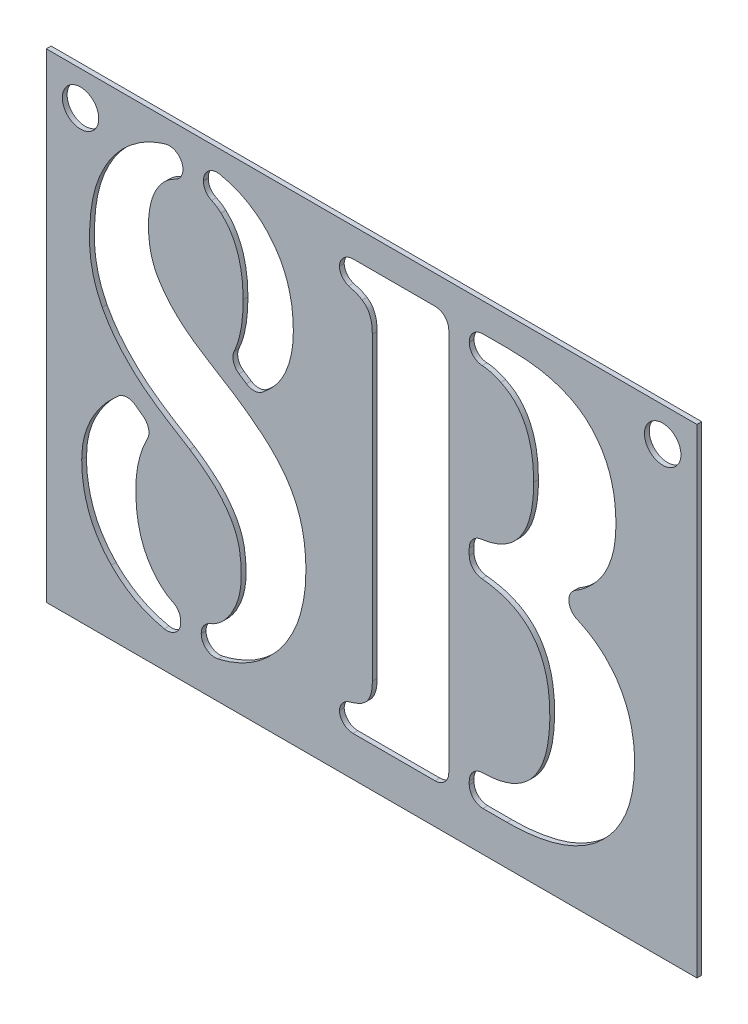
from build123d import *

# Parameters (mm, degrees)
SKETCH1_W           = 120.65
SKETCH1_H           = 88.9
BASE_FLANGE1_DEPTH  = 0.889
SKETCH6_R           = 3.3782
CUT_EXTRUDE1_DEPTH  = 150.868018006
BOSS_EXTRUDE1_DEPTH = 0.889
FILLET1_R           = 2.54
FILLET2_START       = -2
FILLET2_DEPTH       = 3
FILLET2_START_2     = -0.889
FILLET2_2_DEPTH     = 0.889
FILLET3_R           = 2.54


with BuildPart() as part:
    # Base-Flange1: sheet metal written as solids
    # Sketch1 → Base-Flange1 (new body)
    with BuildSketch(Plane.XY):
        with Locations((60.325, 44.45)):
            Rectangle(SKETCH1_W, SKETCH1_H)
    extrude(amount=-BASE_FLANGE1_DEPTH)

    # Sketch6 → Cut-Extrude1 (cut, through all)
    with BuildSketch(Plane.XY):
        with Locations((6.35, 82.55)):
            Circle(SKETCH6_R)
        with Locations((114.3, 82.55)):
            Circle(SKETCH6_R)
        with BuildLine():
            add(Edge.make_bspline(
                [(33.721944791, 55.915194745), (33.945566555, 56.239468675), (34.400665819, 56.899408137), (34.977526537, 57.993937195), (35.450382533, 59.205034013), (35.824194009, 60.526968997), (36.128276898, 61.954453154), (36.348507191, 63.488103854), (36.473228553, 65.13890108), (36.492436497, 66.274115113), (36.502386826, 66.862192243)],
                knots=[0, 0, 0, 0, 0.822761363, 1.674425973, 2.578837131, 3.535199884, 4.542538217, 5.627355092, 6.770894149, 8, 8, 8, 8], degree=3))
            add(Edge.make_bspline(
                [(36.502386826, 66.862192243), (36.491019076, 67.519374521), (36.469056923, 68.789030968), (36.27782028, 70.622482793), (35.960704025, 72.317877956), (35.527108867, 73.884134707), (34.930507519, 75.300528242), (34.23652802, 76.59231579), (33.386691426, 77.72991134), (32.729046696, 78.388517336), (32.403220854, 78.714819433)],
                knots=[0, 0, 0, 0, 1.221156418, 2.35923757, 3.420995774, 4.424200893, 5.372906847, 6.271581767, 7.143666327, 8, 8, 8, 8], degree=3))
            add(Edge.make_bspline(
                [(32.403220854, 78.714819433), (32.165622252, 78.919035816), (31.695385611, 79.32320497), (30.890425669, 79.780138509), (30.039324301, 80.122290806), (29.445096394, 80.253512256), (29.146131613, 80.319531693)],
                knots=[0, 0, 0, 0, 1.019726564, 2.018163364, 3.002908904, 4, 4, 4, 4], degree=3))
            Line((29.146131613, 80.319531693), (29.146131613, 85.260774395))
            add(Edge.make_bspline(
                [(29.146131613, 85.260774395), (29.756585845, 85.202127091), (30.952555803, 85.087228365), (32.694140211, 84.744209224), (34.347778719, 84.295177747), (35.901973134, 83.68577925), (37.352498383, 82.935211663), (38.707878436, 82.056078101), (39.98077677, 81.056030121), (40.731746439, 80.280931788), (41.109976484, 79.890549207)],
                knots=[0, 0, 0, 0, 1.094237954, 2.143773687, 3.164595698, 4.149585034, 5.117961823, 6.075196801, 7.030562178, 8, 8, 8, 8], degree=3))
            add(Edge.make_bspline(
                [(41.109976484, 79.890549207), (41.483320478, 79.457409669), (42.229880258, 78.591279336), (43.205611424, 77.178748314), (43.997062754, 75.643877981), (44.67711555, 74.023214816), (45.170846206, 72.27559908), (45.565996477, 70.436588782), (45.759174965, 68.486869581), (45.794733167, 67.159081803), (45.812895583, 66.480874478)],
                knots=[0, 0, 0, 0, 0.942313705, 1.884303813, 2.821548553, 3.784583717, 4.776355046, 5.810525993, 6.88166066, 8, 8, 8, 8], degree=3))
            add(Edge.make_bspline(
                [(45.812895583, 66.480874478), (45.802665966, 65.902903199), (45.78260664, 64.769555345), (45.5675645, 63.116958505), (45.239433358, 61.552328844), (44.773095776, 60.07992146), (44.191890051, 58.688232618), (43.451158601, 57.399966635), (42.596636904, 56.188948298), (41.913947772, 55.478134391), (41.57073545, 55.120782735)],
                knots=[0, 0, 0, 0, 1.112832737, 2.182161362, 3.204715081, 4.188883333, 5.153447973, 6.103825068, 7.046724824, 8, 8, 8, 8], degree=3))
            add(Edge.make_bspline(
                [(41.57073545, 55.120782735), (41.111278913, 54.694527786), (40.173059358, 53.824106544), (39.152295482, 53.052068132), (38.631411013, 52.658105504)],
                knots=[0, 0, 0, 0, 0.979422212, 2, 2, 2, 2], degree=3))
            Line((38.631411013, 52.658105504), (33.721944791, 55.915194745))
        make_face()
        with BuildLine():
            add(Edge.make_bspline(
                [(19.883287576, 37.421283152), (19.616133771, 37.034156188), (19.082318391, 36.260615542), (18.417754654, 35.012090787), (17.857420287, 33.697964052), (17.404293727, 32.319496353), (17.027789, 30.878279992), (16.784199453, 29.36184477), (16.616481313, 27.780901635), (16.601836045, 26.70247569), (16.594421855, 26.15652085)],
                knots=[0, 0, 0, 0, 0.945460815, 1.889179619, 2.838951615, 3.815876358, 4.805439124, 5.83170644, 6.902297958, 8, 8, 8, 8], degree=3))
            add(Edge.make_bspline(
                [(16.594421855, 26.15652085), (16.609762609, 25.462097074), (16.639473468, 24.117187454), (16.865562184, 22.166698244), (17.227658965, 20.347745192), (17.731504426, 18.65080593), (18.398671097, 17.088594313), (19.218300392, 15.663196806), (20.164782775, 14.358836161), (20.92117593, 13.6111944), (21.297340954, 13.239381568)],
                knots=[0, 0, 0, 0, 1.177536091, 2.280566521, 3.325179602, 4.319742052, 5.277440658, 6.198814698, 7.10424505, 8, 8, 8, 8], degree=3))
            add(Edge.make_bspline(
                [(21.297340954, 13.239381568), (21.562084121, 13.010044579), (22.088059724, 12.554411815), (22.968825281, 11.995673844), (23.918999957, 11.563392679), (24.583669193, 11.357494897), (24.91985972, 11.253351543)],
                knots=[0, 0, 0, 0, 1.006551345, 1.999754922, 2.988273549, 4, 4, 4, 4], degree=3))
            Line((24.91985972, 11.253351543), (24.91985972, 6.327997081))
            add(Edge.make_bspline(
                [(24.91985972, 6.327997081), (24.293622496, 6.374809775), (23.054852732, 6.467410708), (21.244917387, 6.803125292), (19.514866894, 7.30426418), (17.862938713, 7.933798354), (16.287323527, 8.721304592), (14.796919454, 9.663289271), (13.365956526, 10.741996816), (12.502833966, 11.577505264), (12.066273398, 12.000098832)],
                knots=[0, 0, 0, 0, 1.047151902, 2.071387751, 3.064194013, 4.048748296, 5.016869866, 5.997491081, 6.987146818, 8, 8, 8, 8], degree=3))
            add(Edge.make_bspline(
                [(12.066273398, 12.000098832), (11.625333996, 12.466847097), (10.748780669, 13.394706441), (9.652728538, 14.953790064), (8.669071406, 16.57875351), (7.92709237, 18.33693812), (7.305421606, 20.176152507), (6.891899081, 22.122647327), (6.60295647, 24.161841581), (6.580422157, 25.556993189), (6.568942289, 26.267738532)],
                knots=[0, 0, 0, 0, 0.980085918, 1.948334778, 2.906208818, 3.877666549, 4.85801983, 5.869425845, 6.914601361, 8, 8, 8, 8], degree=3))
            add(Edge.make_bspline(
                [(6.568942289, 26.267738532), (6.591184344, 26.958376825), (6.635362827, 28.330163385), (7.059278134, 30.351284056), (7.69956002, 32.318360092), (8.649621943, 34.2027737), (9.812563235, 36.053646292), (11.26863013, 37.824291986), (12.982759879, 39.536631474), (14.265012803, 40.583477629), (14.926156634, 41.123243119)],
                knots=[0, 0, 0, 0, 0.936383992, 1.859901176, 2.792025208, 3.737309031, 4.716592954, 5.754079214, 6.841978331, 8, 8, 8, 8], degree=3))
            Line((14.926156634, 41.123243119), (19.883287576, 37.421283152))
        make_face()
        with BuildLine():
            add(Edge.make_bspline(
                [(26.635789661, 37.850265638), (26.039686526, 38.235384203), (24.860658309, 38.997107516), (23.34318736, 39.898942842), (22.092245717, 40.667911279), (21.075141819, 41.348827271), (19.952396385, 42.114761342), (18.322797978, 43.286540288), (16.267098536, 44.992221903), (13.976278213, 47.323871576), (11.927541966, 49.827349173), (10.873461874, 51.663378568), (10.366231696, 52.546887823)],
                knots=[0, 0, 0, 0, 0.957997565, 1.894816677, 2.382894246, 2.940122698, 3.546974634, 4.217726517, 5.649479433, 7.145999402, 8.6266364, 10, 10, 10, 10], degree=3))
            add(Edge.make_bspline(
                [(10.366231696, 52.546887823), (10.000313966, 53.311535184), (9.268593137, 54.840590365), (8.560004187, 57.291999002), (8.09775042, 59.820913851), (7.97979366, 62.397459272), (8.069223305, 64.912208426), (8.276955666, 67.287357049), (8.657611603, 69.471289608), (9.185123829, 71.479958251), (9.85036622, 73.338819652), (10.679173927, 75.058289068), (11.581074031, 76.691668189), (12.309636946, 77.683835584), (12.670026525, 78.174619266)],
                knots=[0, 0, 0, 0, 1.129177947, 2.258002154, 3.391746644, 4.552233604, 5.690328946, 6.747726653, 7.730442153, 8.64388975, 9.515557073, 10.359434416, 11.188480873, 12, 12, 12, 12], degree=3))
            add(Edge.make_bspline(
                [(12.670026525, 78.174619266), (13.0775734, 78.676937987), (13.88198963, 79.668414936), (15.259365749, 80.965887267), (16.720469178, 82.103566701), (18.253164362, 83.096673513), (19.899694607, 83.896097827), (21.629158153, 84.530289507), (23.455969981, 84.998011187), (24.711124038, 85.172248149), (25.348842205, 85.260774395)],
                knots=[0, 0, 0, 0, 1.038259764, 2.049317656, 3.031389794, 4.010915357, 4.977457628, 5.965372969, 6.966247518, 8, 8, 8, 8], degree=3))
            Line((25.348842205, 85.260774395), (25.348842205, 80.367196413))
            add(Edge.make_bspline(
                [(25.348842205, 80.367196413), (24.884788281, 80.245952492), (23.961589675, 80.004747294), (22.715597501, 79.246928611), (21.60224196, 78.247448168), (20.657959097, 76.978148231), (19.873806951, 75.504628615), (19.342445028, 73.818032714), (19.009817626, 71.96571066), (18.913856923, 69.997439887), (19.0049849, 68.044835318), (19.267451392, 66.221865267), (19.703497286, 64.583106765), (20.53730275, 62.682643728), (21.920667043, 60.607391044), (23.84901457, 58.397699741), (26.04403569, 56.507741221), (28.424702875, 54.806143471), (31.049023747, 53.211039001), (33.854845214, 51.471969087), (36.791465186, 49.542865534), (39.192261275, 47.717549888), (41.035602971, 46.163668204), (42.30835153, 44.942111166), (43.448219585, 43.68580327), (44.119076586, 42.796550364), (44.446506926, 42.362525855)],
                knots=[0, 0, 0, 0, 0.656148608, 1.305355797, 1.980607929, 2.702729208, 3.467923402, 4.264401579, 5.12252757, 6.048403816, 6.966636849, 7.805654903, 8.575612407, 9.28961639, 10.648530219, 11.984537431, 13.310272413, 14.619355613, 16.002846876, 17.529855676, 19.157104223, 20.829921906, 21.671588303, 22.469561966, 23.25302733, 24, 24, 24, 24], degree=3))
            add(Edge.make_bspline(
                [(44.446506926, 42.362525855), (44.746305022, 41.917587426), (45.344141131, 41.030322755), (46.093789274, 39.595835723), (46.722777946, 38.089131604), (47.258696634, 36.504981115), (47.646892464, 34.832569937), (47.930900327, 33.086185862), (48.110981675, 31.260360003), (48.13577674, 30.017785246), (48.148466892, 29.381833611)],
                knots=[0, 0, 0, 0, 0.938169888, 1.870831882, 2.826009256, 3.793024893, 4.79321492, 5.826095895, 6.887392601, 8, 8, 8, 8], degree=3))
            add(Edge.make_bspline(
                [(48.148466892, 29.381833611), (48.13445697, 28.607979387), (48.106838063, 27.082417184), (47.851705837, 24.843527321), (47.412218923, 22.707154681), (46.8546659, 20.656210045), (46.083831038, 18.719101874), (45.153564155, 16.874483359), (44.066658288, 15.122099031), (43.207667184, 14.046962308), (42.778241705, 13.509481651)],
                knots=[0, 0, 0, 0, 1.084919702, 2.138791053, 3.153956352, 4.141443254, 5.115093293, 6.071627084, 7.035970851, 8, 8, 8, 8], degree=3))
            add(Edge.make_bspline(
                [(42.778241705, 13.509481651), (42.321995701, 13.001960239), (41.421423276, 12.000176587), (39.90841846, 10.675998716), (38.30455025, 9.512183787), (36.59200664, 8.518268183), (34.774616687, 7.70726043), (32.85140017, 7.074268757), (30.832846743, 6.58659523), (29.43973319, 6.415028901), (28.733037368, 6.327997081)],
                knots=[0, 0, 0, 0, 1.011225634, 1.996032651, 2.974714502, 3.945899917, 4.926690626, 5.92007151, 6.944898088, 8, 8, 8, 8], degree=3))
            Line((28.733037368, 6.327997081), (28.733037368, 11.253351543))
            add(Edge.make_bspline(
                [(28.733037368, 11.253351543), (29.305129151, 11.401063681), (30.438440622, 11.69368082), (31.957750216, 12.615561733), (33.308802054, 13.845857971), (33.977697082, 14.889165294), (34.325697918, 15.431958715)],
                knots=[0, 0, 0, 0, 0.980340632, 1.942050765, 2.929326687, 4, 4, 4, 4], degree=3))
            add(Edge.make_bspline(
                [(34.325697918, 15.431958715), (34.606241209, 15.949161238), (35.167555764, 16.983986569), (35.729688129, 18.675424926), (36.090299837, 20.4470916), (36.174377592, 22.26340367), (36.130592962, 24.00485288), (35.972298383, 25.592320262), (35.731207827, 26.978330959), (35.263563781, 28.541410796), (34.467188249, 30.267801121), (33.227870454, 32.103828162), (31.81735753, 33.797685683), (30.160739126, 35.256948147), (28.441997153, 36.626235469), (27.234412579, 37.444591033), (26.635789661, 37.850265638)],
                knots=[0, 0, 0, 0, 0.934486164, 1.869731703, 2.823169704, 3.802321356, 4.754753641, 5.593136125, 6.338459668, 6.988927459, 8.184121003, 9.345545268, 10.505287395, 11.680202914, 12.850031932, 14, 14, 14, 14], degree=3))
        make_face()
        with BuildLine():
            add(Edge.make_bspline(
                [(78.431452714, 50.338422435), (78.914186188, 50.343534872), (79.851337753, 50.35345987), (81.209042658, 50.546186921), (82.483455836, 50.794090968), (83.652381804, 51.209573269), (84.738299018, 51.688888938), (85.72601258, 52.305788518), (86.611115618, 53.038560154), (87.416395155, 53.871090917), (88.119811677, 54.817024849), (88.720123224, 55.878189845), (89.253734078, 57.037113933), (89.652870045, 58.322511818), (89.998060508, 59.704427528), (90.203211067, 61.206643551), (90.356139459, 62.812833576), (90.371490454, 63.922445457), (90.379409344, 64.494844453)],
                knots=[0, 0, 0, 0, 1.091324336, 2.118635568, 3.098931437, 4.023802071, 4.919554848, 5.780968474, 6.649606692, 7.514266393, 8.396443925, 9.309275326, 10.269507892, 11.27776313, 12.350499074, 13.489616614, 14.705005818, 16, 16, 16, 16], degree=3))
            add(Edge.make_bspline(
                [(90.379409344, 64.494844453), (90.362909376, 65.300794245), (90.331314035, 66.844085571), (90.044235787, 69.048346549), (89.579563223, 71.030292376), (88.911733248, 72.786899467), (88.049998881, 74.319586877), (86.992623768, 75.625941355), (85.733489604, 76.705860479), (84.766142603, 77.217516709), (84.278325108, 77.475536697)],
                knots=[0, 0, 0, 0, 1.273550566, 2.438687324, 3.506778572, 4.484739009, 5.399599483, 6.274353955, 7.129784522, 8, 8, 8, 8], degree=3))
            add(Edge.make_bspline(
                [(84.278325108, 77.475536697), (83.941650027, 77.624169638), (83.309156363, 77.903398483), (82.370378587, 78.217280556), (81.50473873, 78.396623762), (80.947750412, 78.429406588), (80.687582822, 78.444719349)],
                knots=[0, 0, 0, 0, 1.178588215, 2.214151332, 3.16583539, 4, 4, 4, 4], degree=3))
            Line((80.687582822, 78.444719349), (78.90809992, 78.444719349))
            add(Edge.make_bspline(
                [(78.90809992, 78.444719349), (78.823179878, 78.44120605), (78.663346585, 78.43459345), (78.505455608, 78.409034166), (78.431452714, 78.397054629)],
                knots=[0, 0, 0, 0, 1.062607685, 2, 2, 2, 2], degree=3))
            Line((78.431452714, 78.397054629), (78.431452714, 83.592509174))
            Line((78.431452714, 83.592509174), (85.771819686, 83.592509174))
            add(Edge.make_bspline(
                [(85.771819686, 83.592509174), (86.593295137, 83.57739494), (88.1811475, 83.548180225), (90.479690198, 83.320532346), (92.613981983, 82.968741198), (94.58054334, 82.440282196), (96.385684195, 81.774194779), (98.035910107, 80.969458038), (99.507937921, 79.994360178), (100.803085526, 78.871317705), (101.946466694, 77.619129226), (102.92584842, 76.230332344), (103.779119131, 74.729184238), (104.463055629, 73.096294806), (104.982051978, 71.336285303), (105.36523783, 69.455252724), (105.585085138, 67.444674946), (105.616151183, 66.063017302), (105.632119937, 65.352809424)],
                knots=[0, 0, 0, 0, 1.277015389, 2.468377965, 3.587940399, 4.636606522, 5.62930242, 6.575735692, 7.484709474, 8.366265355, 9.234802907, 10.114510821, 11.00311497, 11.914621549, 12.860302246, 13.851870449, 14.895805674, 16, 16, 16, 16], degree=3))
            add(Edge.make_bspline(
                [(105.632119937, 65.352809424), (105.621620093, 64.748418041), (105.601015993, 63.562406085), (105.389212339, 61.829189675), (105.048669411, 60.187807511), (104.540037741, 58.646012613), (103.935242155, 57.182925056), (103.160875961, 55.822289785), (102.251936188, 54.55182302), (101.541682599, 53.789425455), (101.183412681, 53.404852794)],
                knots=[0, 0, 0, 0, 1.107259912, 2.172803139, 3.195158917, 4.174395064, 5.144350059, 6.091898045, 7.037504995, 8, 8, 8, 8], degree=3))
            add(Edge.make_bspline(
                [(101.183412681, 53.404852794), (100.850852835, 53.079818637), (100.18315045, 52.427226076), (99.061560861, 51.577070115), (97.864921594, 50.803991067), (96.570743336, 50.144502392), (95.204588446, 49.551672158), (93.748732211, 49.058079808), (92.206695951, 48.663642468), (91.143346127, 48.467940257), (90.601844707, 48.36828065)],
                knots=[0, 0, 0, 0, 0.935390857, 1.878046054, 2.827491028, 3.800356325, 4.798599963, 5.823646477, 6.891711368, 8, 8, 8, 8], degree=3))
            Line((90.601844707, 48.36828065), (90.601844707, 48.145845287))
            add(Edge.make_bspline(
                [(90.601844707, 48.145845287), (91.254311213, 48.109340586), (92.527815788, 48.038089565), (94.388012008, 47.744948162), (96.150879068, 47.315633741), (97.829983634, 46.763887943), (99.41414506, 46.05767446), (100.903914782, 45.218138181), (102.307493315, 44.242636563), (103.155462263, 43.488892174), (103.582536951, 43.109273144)],
                knots=[0, 0, 0, 0, 1.101209382, 2.149374987, 3.169399366, 4.157664196, 5.125014668, 6.088566413, 7.037317457, 8, 8, 8, 8], degree=3))
            add(Edge.make_bspline(
                [(103.582536951, 43.109273144), (104.021055625, 42.65708822), (104.894149366, 41.756784881), (106.032072067, 40.255501668), (106.964512901, 38.61798182), (107.757722813, 36.873015222), (108.354889203, 34.994218997), (108.777144679, 32.992634668), (109.061526679, 30.878161798), (109.084180972, 29.425166512), (109.0957563, 28.682751042)],
                knots=[0, 0, 0, 0, 0.950924961, 1.893298235, 2.835943106, 3.791969056, 4.783677115, 5.806704274, 6.879324186, 8, 8, 8, 8], degree=3))
            add(Edge.make_bspline(
                [(109.0957563, 28.682751042), (109.077095535, 27.924589696), (109.040565078, 26.44040723), (108.764996011, 24.270879528), (108.321494811, 22.212713667), (107.70966695, 20.26335733), (106.883992907, 18.437992226), (105.902346581, 16.719571946), (104.737917958, 15.107212438), (103.822040076, 14.150764656), (103.360101588, 13.668364053)],
                knots=[0, 0, 0, 0, 1.101506446, 2.156317467, 3.172227974, 4.157956163, 5.119102677, 6.077503008, 7.030356151, 8, 8, 8, 8], degree=3))
            add(Edge.make_bspline(
                [(103.360101588, 13.668364053), (102.821752903, 13.160742023), (101.742847479, 12.143415935), (99.888615193, 10.882641979), (97.897530464, 9.790790704), (95.725501332, 8.914476228), (93.387241714, 8.237309463), (90.882762557, 7.750863491), (88.215907579, 7.438434066), (86.381782885, 7.408110151), (85.438166642, 7.392509174)],
                knots=[0, 0, 0, 0, 0.909610263, 1.82295132, 2.75069913, 3.701101728, 4.699660518, 5.743017525, 6.83883286, 8, 8, 8, 8], degree=3))
            Line((85.438166642, 7.392509174), (78.431452714, 7.392509174))
            Line((78.431452714, 7.392509174), (78.431452714, 13.287046288))
            add(Edge.make_bspline(
                [(78.431452714, 13.287046288), (78.737722382, 13.225405107), (79.470983671, 13.077825714), (80.219772656, 13.079515293), (80.655806342, 13.080499166)],
                knots=[0, 0, 0, 0, 0.83536298, 2, 2, 2, 2], degree=3))
            add(Edge.make_bspline(
                [(80.655806342, 13.080499166), (81.169796853, 13.094261725), (82.169082301, 13.121018494), (83.621052251, 13.282675706), (84.959804208, 13.617674154), (86.218400631, 14.014166542), (87.362812894, 14.582842276), (88.424250625, 15.250438516), (89.385655658, 16.047502281), (90.226271024, 16.982505815), (90.986766659, 18.018647021), (91.609987508, 19.194575883), (92.179682219, 20.467159539), (92.6133997, 21.877849953), (92.969191098, 23.405763504), (93.190250714, 25.060933543), (93.359669001, 26.830719359), (93.398536078, 28.683065689), (93.341962977, 30.534977721), (93.167209182, 32.30791708), (92.891477376, 33.963615692), (92.475880799, 35.494269941), (91.953272283, 36.900429906), (91.316276891, 38.189440809), (90.545236756, 39.350596376), (89.678519971, 40.414177507), (88.657119458, 41.319249352), (87.544250582, 42.123502059), (86.305381056, 42.785977118), (84.965866992, 43.357649317), (83.490566026, 43.748105076), (81.913553199, 44.08342594), (80.208926149, 44.24444278), (79.035426816, 44.271220843), (78.431452714, 44.285002919)],
                knots=[0, 0, 0, 0, 1.032210394, 2.006793518, 2.924873458, 3.799053519, 4.650236015, 5.482006028, 6.312415829, 7.147779697, 8.000620709, 8.885660565, 9.814086946, 10.795950511, 11.843111406, 12.960313531, 14.145279367, 15.410926016, 16.676885242, 17.862852357, 18.985052045, 20.042525811, 21.041793083, 21.99277562, 22.921688917, 23.835139697, 24.738447969, 25.653073686, 26.585630746, 27.553170773, 28.569655006, 29.643518112, 30.787170992, 32, 32, 32, 32], degree=3))
            Line((78.431452714, 44.285002919), (78.431452714, 50.338422435))
        make_face()
        with BuildLine():
            Line((74.634163306, 7.392509174), (54.34488057, 7.392509174))
            Line((54.34488057, 7.392509174), (54.34488057, 11.364569224))
            add(Edge.make_bspline(
                [(54.34488057, 11.364569224), (54.722441586, 11.543878551), (55.448531767, 11.888709548), (56.570451278, 12.233150923), (57.630109614, 12.562797312), (58.26321512, 12.911091648), (58.571152464, 13.080499166)],
                knots=[0, 0, 0, 0, 1.095819923, 2.10737882, 3.079444527, 4, 4, 4, 4], degree=3))
            add(Edge.make_bspline(
                [(58.571152464, 13.080499166), (58.865883479, 13.301310208), (59.473748669, 13.756719849), (60.04438792, 14.829452415), (60.423559426, 16.115041325), (60.448439346, 17.064813327), (60.461853048, 17.576871142)],
                knots=[0, 0, 0, 0, 0.858619286, 1.77085121, 2.798182029, 4, 4, 4, 4], degree=3))
            Line((60.461853048, 17.576871142), (60.461853048, 73.296929524))
            add(Edge.make_bspline(
                [(60.461853048, 73.296929524), (60.448503503, 73.81939649), (60.423843752, 74.784515998), (60.048645877, 76.088608147), (59.469297238, 77.1649914), (58.865398146, 77.630189758), (58.571152464, 77.856854462)],
                knots=[0, 0, 0, 0, 1.213040899, 2.240772171, 3.142828328, 4, 4, 4, 4], degree=3))
            add(Edge.make_bspline(
                [(58.571152464, 77.856854462), (58.263853359, 78.02812916), (57.633558102, 78.379427385), (56.563734083, 78.679203279), (55.452413463, 79.054763462), (54.723239903, 79.395816244), (54.34488057, 79.572784403)],
                knots=[0, 0, 0, 0, 0.920556366, 1.888135378, 2.904179015, 4, 4, 4, 4], degree=3))
            Line((54.34488057, 79.572784403), (54.34488057, 83.592509174))
            Line((54.34488057, 83.592509174), (74.634163306, 83.592509174))
            Line((74.634163306, 83.592509174), (74.634163306, 7.392509174))
        make_face()
    extrude(amount=-CUT_EXTRUDE1_DEPTH, mode=Mode.SUBTRACT)

    # Sketch7 → Boss-Extrude1 (add)
    with BuildSketch(Plane.XY):
        Polygon((78.90809992, 78.444719349), (78.431452714, 78.444719349), (78.431452714, 78.397054629), align=None)
    extrude(amount=-BOSS_EXTRUDE1_DEPTH)

    # Fillet1
    fillet1_edges = [part.edges().sort_by_distance(p)[0] for p in [
        (25.348842205, 85.260774395, -0.4445),
        (25.348842205, 80.367196413, -0.4445),
        (29.146131613, 85.260774395, -0.4445),
        (29.146131613, 80.319531693, -0.4445),
        (38.631411013, 52.658105504, -0.4445),
        (33.721944791, 55.915194745, -0.4445),
        (19.883287576, 37.421283152, -0.4445),
        (14.926156634, 41.123243119, -0.4445),
        (28.733037368, 6.327997081, -0.4445),
        (28.733037368, 11.253351543, -0.4445),
        (24.91985972, 6.327997081, -0.4445),
        (24.91985972, 11.253351543, -0.4445),
    ]]
    fillet(fillet1_edges, radius=FILLET1_R)

    # Fillet2: read off the stored shape, not the designer's step
    # Fillet2 outline → Fillet2 (cut)
    with BuildSketch(Plane.XY.offset(FILLET2_START)):
        with BuildLine():
            ThreePointArc((90.601844707, 48.145845287), (91.057611525, 48.395723145), (91.554700922, 48.54759305))
            add(Edge.make_bspline(
                [(91.554700922, 48.54759305), (91.237608674, 48.48528863), (90.919726691, 48.42678464), (90.601844707, 48.36828065)],
                knots=[0.918674039, 0.918674039, 0.918674039, 0.918674039, 1, 1, 1, 1], degree=3))
            Line((90.601844707, 48.36828065), (90.601844707, 48.145845287))
        make_face()
    extrude(amount=FILLET2_DEPTH, mode=Mode.SUBTRACT)

    # Fillet2 2 outline → Fillet2 2 (add)
    with BuildSketch(Plane.XY.offset(FILLET2_START_2)):
        with BuildLine():
            ThreePointArc((80.817445172, 78.436994315), (79.121752852, 79.231571095), (78.431452714, 80.972321055))
            Line((78.431452714, 80.972321055), (78.431452714, 78.444719349))
            Line((78.431452714, 78.444719349), (80.687582822, 78.444719349))
            add(Edge.make_bspline(
                [(80.817445172, 78.436994315), (80.7741638, 78.439623427), (80.730873311, 78.442171388), (80.687582822, 78.444719349)],
                knots=[0.965299873, 0.965299873, 0.965299873, 0.965299873, 1, 1, 1, 1], degree=3))
        make_face()
        with BuildLine():
            Line((78.431452714, 83.592509174), (78.431452714, 81.052509174))
            ThreePointArc((78.431452714, 81.052509174), (79.17540149, 82.848560398), (80.971452714, 83.592509174))
            Line((80.971452714, 83.592509174), (78.431452714, 83.592509174))
        make_face()
        with BuildLine():
            ThreePointArc((80.971452714, 7.392509174), (79.17540149, 8.13645795), (78.431452714, 9.932509174))
            Line((78.431452714, 9.932509174), (78.431452714, 7.392509174))
            Line((78.431452714, 7.392509174), (80.971452714, 7.392509174))
        make_face()
        with BuildLine():
            Line((78.431452714, 50.338422435), (78.431452714, 47.951639274))
            ThreePointArc((78.431452714, 47.951639274), (79.057152805, 49.621087045), (80.625984887, 50.4680359))
            add(Edge.make_bspline(
                [(78.431452714, 50.338422435), (78.914186188, 50.343534872), (79.64835121, 50.351310121), (80.377033153, 50.433858134), (80.625984887, 50.4680359)],
                knots=[0, 0, 0, 0, 0.068207771, 0.103733763, 0.103733763, 0.103733763, 0.103733763], degree=3))
        make_face()
        with BuildLine():
            add(Edge.make_bspline(
                [(80.761113175, 44.18465137), (80.588458784, 44.198998303), (79.812491469, 44.253489016), (79.035426816, 44.271220843), (78.431452714, 44.285002919)],
                knots=[0.951237222, 0.951237222, 0.951237222, 0.951237222, 0.962099094, 1, 1, 1, 1], degree=3))
            ThreePointArc((80.761113175, 44.18465137), (79.102514188, 44.995849057), (78.431452714, 46.71592719))
            Line((78.431452714, 46.71592719), (78.431452714, 44.285002919))
        make_face()
        with BuildLine():
            ThreePointArc((78.431452714, 10.548131312), (79.150555445, 12.318987923), (80.900691404, 13.087145458))
            add(Edge.make_bspline(
                [(80.655806342, 13.080499166), (80.73743578, 13.082684867), (80.819065219, 13.084870569), (80.900691404, 13.087145458)],
                knots=[0, 0, 0, 0, 0.00512283, 0.00512283, 0.00512283, 0.00512283], degree=3))
            add(Edge.make_bspline(
                [(78.431452714, 13.287046288), (78.737722382, 13.225405107), (79.470983671, 13.077825714), (80.219772656, 13.079515293), (80.655806342, 13.080499166)],
                knots=[0, 0, 0, 0, 0.41768149, 1, 1, 1, 1], degree=3))
            Line((78.431452714, 13.287046288), (78.431452714, 10.548131312))
        make_face()
        with BuildLine():
            Line((74.634163306, 7.392509174), (74.634163306, 9.932509174))
            ThreePointArc((74.634163306, 9.932509174), (73.89021453, 8.13645795), (72.094163306, 7.392509174))
            Line((72.094163306, 7.392509174), (74.634163306, 7.392509174))
        make_face()
        with BuildLine():
            ThreePointArc((54.346913431, 81.154110339), (55.12511737, 82.884129626), (56.88488057, 83.592509174))
            Line((56.88488057, 83.592509174), (54.34488057, 83.592509174))
            Line((54.34488057, 83.592509174), (54.34488057, 79.572784403))
            add(Edge.make_bspline(
                [(56.060651851, 78.853161397), (55.868299807, 78.919150481), (55.285954187, 79.132620645), (54.723239903, 79.395816244), (54.34488057, 79.572784403)],
                knots=[0.592560519, 0.592560519, 0.592560519, 0.592560519, 0.726044754, 1, 1, 1, 1], degree=3))
            ThreePointArc((56.060651851, 78.853161397), (54.847803803, 79.738504122), (54.346913431, 81.154110339))
        make_face()
        with BuildLine():
            ThreePointArc((72.094163306, 83.592509174), (73.89021453, 82.848560398), (74.634163306, 81.052509174))
            Line((74.634163306, 81.052509174), (74.634163306, 83.592509174))
            Line((74.634163306, 83.592509174), (72.094163306, 83.592509174))
        make_face()
        with BuildLine():
            Line((54.34488057, 7.392509174), (56.88488057, 7.392509174))
            ThreePointArc((56.88488057, 7.392509174), (55.13571013, 8.090770113), (54.348254173, 9.801640852))
            ThreePointArc((54.348254173, 9.801640852), (54.871118527, 11.218791404), (56.106179318, 12.088462411))
            add(Edge.make_bspline(
                [(54.34488057, 11.364569224), (54.722441586, 11.543878551), (55.297377105, 11.816923957), (55.898446119, 12.021554698), (56.106179318, 12.088462411)],
                knots=[0, 0, 0, 0, 0.273954981, 0.4171682, 0.4171682, 0.4171682, 0.4171682], degree=3))
            Line((54.34488057, 11.364569224), (54.34488057, 7.392509174))
        make_face()
    extrude(amount=FILLET2_2_DEPTH)

    # Fillet3
    fillet3_edges = [part.edges().sort_by_distance(p)[0] for p in [
        (90.601844707, 48.145845287, -0.4445),
    ]]
    fillet(fillet3_edges, radius=FILLET3_R)


solid = part.part
